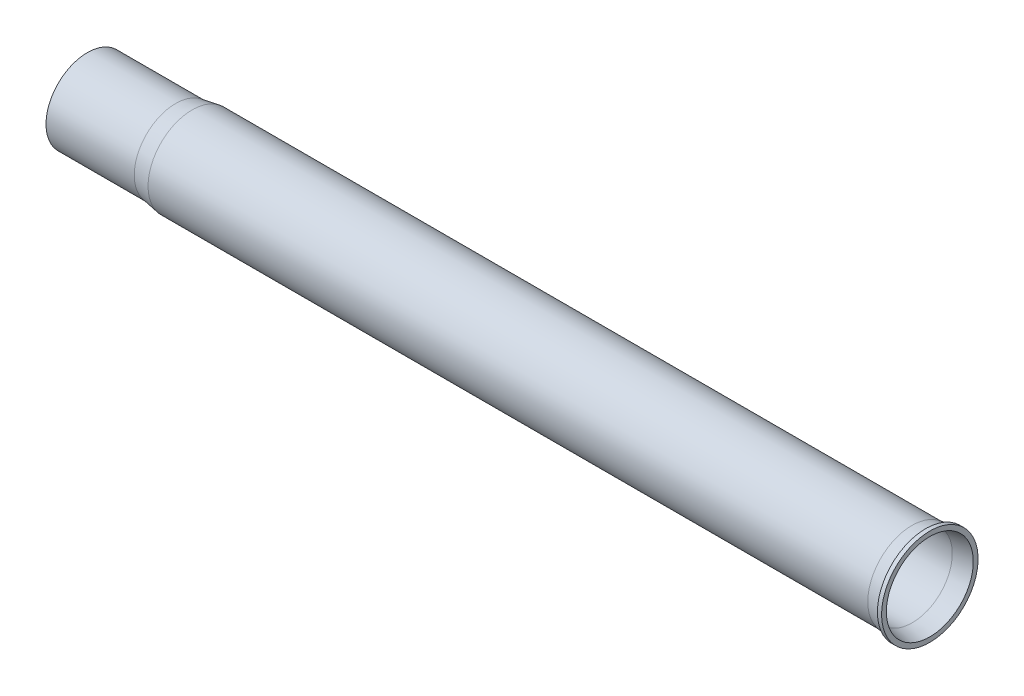
from build123d import *


with BuildPart() as part:
    # Esquisse1 → Base-Révolution (revolve)
    with BuildSketch(Plane.XY):
        Polygon((0, 15), (32, 15), (38, 16), (299, 16), (304, 17), (304, 17.5), (305.5, 17.5), (305.5, 15.770294146), (299.14852927, 14.5), (38.124143795, 14.5), (32.124143795, 13.5), (0, 13.5), align=None)
    revolve(axis=Axis((0, 0, 0), (1, 0, 0)))


solid = part.part
